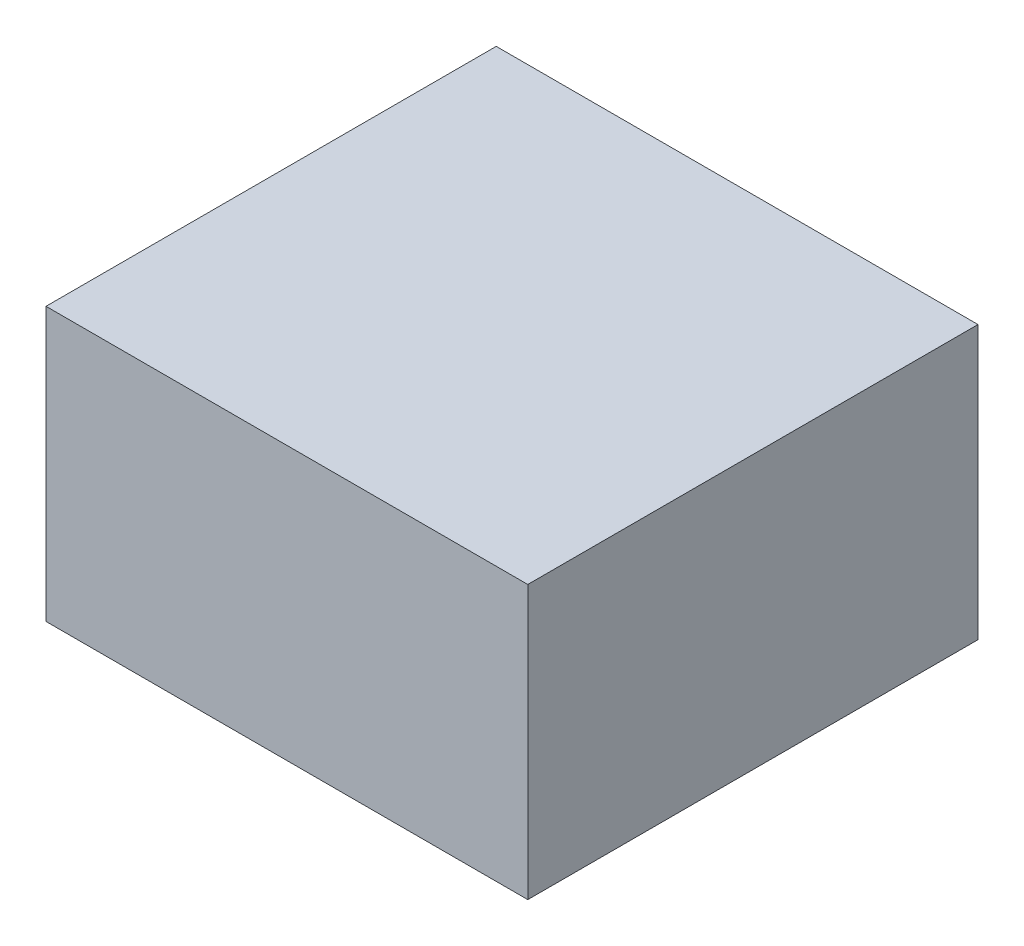
from build123d import *

# Parameters (mm, degrees)
SKETCH_1_W      = 85.60949913
SKETCH_1_H      = 48.50263152
EXTRUDE_1_DEPTH = 80


with BuildPart() as part:
    # 草图1 → 凸台-拉伸1 (new body)
    with BuildSketch(Plane.XY):
        Rectangle(SKETCH_1_W, SKETCH_1_H)
    extrude(amount=EXTRUDE_1_DEPTH)


solid = part.part
